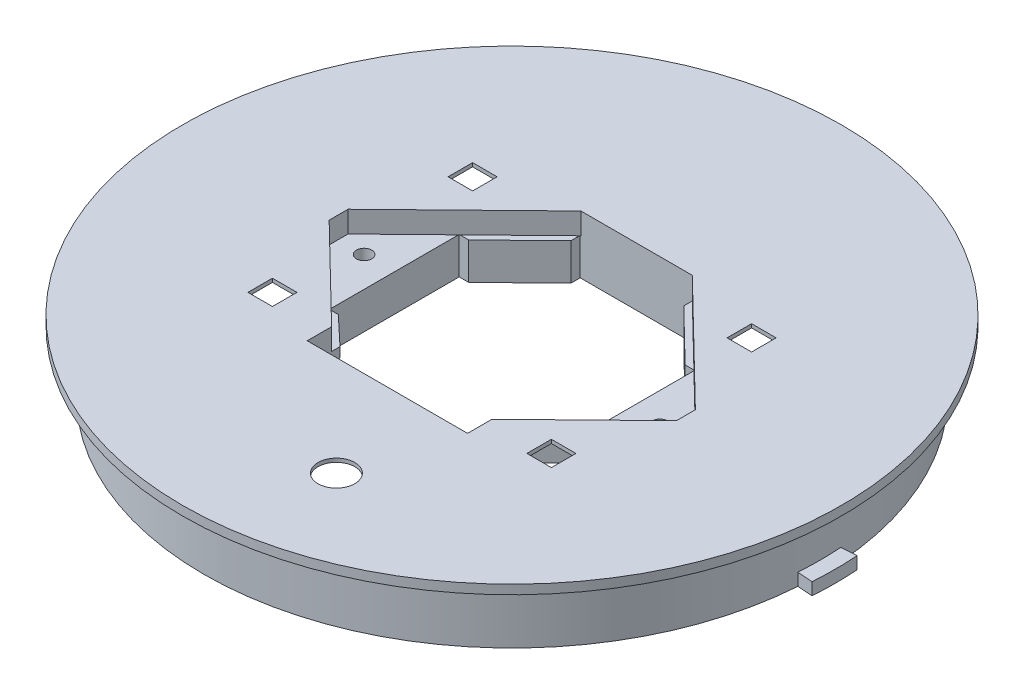
from build123d import *
from build123d.topology import SkipClean

# Parameters (mm, degrees)
SKETCH1_R           = 50.25
BOSS_EXTRUDE1_DEPTH = 8
SKETCH2_R           = 53.75
BOSS_EXTRUDE3_DEPTH = 1.5
SHELL1_T            = -1.6
REVOLVE1_START      = -1
REVOLVE1_DEPTH      = 1
BOSS_EXTRUDE4_START = 7.9
SKETCH6_R           = 48.65
BOSS_EXTRUDE4_DEPTH = 7.9
SKETCH5_W           = 9
SKETCH5_H           = 1.5
CUT_EXTRUDE1_DEPTH  = 3.5
SKETCH7_W           = 38
SKETCH7_H           = 20.772875816
SKETCH7_W_2         = 18
SKETCH7_H_2         = 9.738562092
CUT_EXTRUDE2_DEPTH  = 77.335607681
SHELL3_OUTLINE_R    = 48.65
SHELL3_DEPTH        = 7.9
SHELL3_2_DEPTH      = 4.4
BOSS_EXTRUDE6_DEPTH = 4.4
SKETCH8_R           = 1.25
CUT_EXTRUDE3_DEPTH  = 4
CUT_EXTRUDE4_START  = -4.4
SKETCH10_W          = 28.95
SKETCH10_H          = 4.698503494
CUT_EXTRUDE4_DEPTH  = 4.4
SKETCH11_R          = 3
CUT_EXTRUDE5_DEPTH  = 77.533228078
CUT_EXTRUDE6_DEPTH  = 3.5
SKETCH13_R          = 48.65
CUT_EXTRUDE7_DEPTH  = 1
CUT_EXTRUDE8_DEPTH  = 77.335607681
BOSS_EXTRUDE7_START = 1
SKETCH15_R          = 50.25
SKETCH15_R_2        = 48.65
BOSS_EXTRUDE7_DEPTH = 1
CUT_EXTRUDE9_DEPTH  = 77.335607681
BOSS_EXTRUDE8_DEPTH = 4.4
CUT_EXTRUDE10_DEPTH = 77.605319659
CUT_EXTRUDE11_START = -4.4
SKETCH19_W          = 8.012946077
SKETCH19_H          = 6.440058598
CUT_EXTRUDE11_DEPTH = 4.4
BOSS_EXTRUDE9_START = 1
SKETCH20_R          = 48.65
BOSS_EXTRUDE9_DEPTH = 1
SKETCH21_W          = 4
SKETCH21_H          = 4
CUT_EXTRUDE12_DEPTH = 77.878963312


# Read off the part's stored shape, not the designer's step: Revolve1, Shell3
with BuildPart() as part:
    # Sketch1 → Boss-Extrude1 (new body)
    with BuildSketch(Plane(origin=(0, 0, 0), x_dir=(1, 0, 0), z_dir=(0, 1, 0))):
        with Locations(Location((0, 0, 0), (0, 0, 270))):
            Circle(SKETCH1_R)
    extrude(amount=BOSS_EXTRUDE1_DEPTH)

    # Sketch2 → Boss-Extrude3 (add)
    with BuildSketch(Plane(origin=(0, 8, 0), x_dir=(1, 0, 0), z_dir=(0, 1, 0))):
        with Locations(Location((0, 0, 0), (0, 0, 270))):
            Circle(SKETCH2_R)
    extrude(amount=BOSS_EXTRUDE3_DEPTH)

    # Shell1
    shell1_openings = [part.faces().sort_by_distance(p)[0] for p in [
        (0, 0, 0),
    ]]
    offset(amount=SHELL1_T, openings=shell1_openings, kind=Kind.INTERSECTION)

    # Revolve1 outline → Revolve1 (add)
    with BuildSketch(Plane(origin=(0, 0, 0), x_dir=(1, 0, 0), z_dir=(0, 1, 0)).offset(REVOLVE1_START)):
        with BuildLine():
            ThreePointArc((-52.621503651, 3.67965399), (-52.75, 0), (-52.621503651, -3.67965399))
            Line((-52.621503651, -3.67965399), (-48.531491045, -3.393652448))
            ThreePointArc((-48.531491045, -3.393652448), (-48.65, 0), (-48.531491045, 3.393652448))
            Line((-48.531491045, 3.393652448), (-52.621503651, 3.67965399))
        make_face()
    revolve1 = extrude(amount=REVOLVE1_DEPTH)

    # Mirror1: Revolve1 across plane
    add(revolve1.mirror(Plane(origin=(0, 0, 0), x_dir=(0, 0, 1), z_dir=(1, 0, 0))))

    # Sketch6 → Boss-Extrude4 (add)
    with BuildSketch(Plane.XZ.offset(-7.9).offset(BOSS_EXTRUDE4_START)):
        Circle(SKETCH6_R)
    extrude(amount=-BOSS_EXTRUDE4_DEPTH)

    # Sketch5 → Cut-Extrude1 (cut)
    with BuildSketch(Plane(origin=(0, 9.5, 0), x_dir=(1, 0, 0), z_dir=(0, 1, 0))):
        with BuildLine():
            ThreePointArc((0, -14), (-4.78887909, -13.155479355), (-9, -10.723805295))
            Line((-9, -10.723805295), (-9, -20.125))
            Line((-9, -20.125), (0, -20.125))
            Line((0, -20.125), (0, -14))
        make_face()
        with BuildLine():
            ThreePointArc((9, -10.723805295), (4.78887909, -13.155479355), (0, -14))
            Line((0, -14), (0, -20.125))
            Line((0, -20.125), (9, -20.125))
            Line((9, -20.125), (9, -10.723805295))
        make_face()
        with BuildLine():
            ThreePointArc((13.919410907, -1.5), (12.352914438, -6.588285429), (9, -10.723805295))
            Line((9, -10.723805295), (9, -20.125))
            Line((9, -20.125), (12.875, -16.35130719))
            Line((12.875, -16.35130719), (28.125, -1.5))
            Line((28.125, -1.5), (13.919410907, -1.5))
        make_face()
        Polygon((12.875, -16.35130719), (9, -20.125), (12.875, -20.125), align=None)
        Polygon((-9, -20.125), (-12.875, -16.35130719), (-12.875, -20.125), align=None)
        with BuildLine():
            Line((-13.919410907, -1.5), (-28.125, -1.5))
            Line((-28.125, -1.5), (-12.875, -16.35130719))
            Line((-12.875, -16.35130719), (-9, -20.125))
            Line((-9, -20.125), (-9, -10.723805295))
            ThreePointArc((-9, -10.723805295), (-12.352914438, -6.588285429), (-13.919410907, -1.5))
        make_face()
        with BuildLine():
            Line((-9, -1.5), (-13.919410907, -1.5))
            ThreePointArc((-13.919410907, -1.5), (-12.352914438, -6.588285429), (-9, -10.723805295))
            Line((-9, -10.723805295), (-9, -1.5))
        make_face()
        with BuildLine():
            Line((0, -1.5), (-9, -1.5))
            Line((-9, -1.5), (-9, -10.723805295))
            ThreePointArc((-9, -10.723805295), (-4.78887909, -13.155479355), (0, -14))
            Line((0, -14), (0, -1.5))
        make_face()
        with BuildLine():
            Line((9, -1.5), (0, -1.5))
            Line((0, -1.5), (0, -14))
            ThreePointArc((0, -14), (4.78887909, -13.155479355), (9, -10.723805295))
            Line((9, -10.723805295), (9, -1.5))
        make_face()
        with BuildLine():
            Line((13.919410907, -1.5), (9, -1.5))
            Line((9, -1.5), (9, -10.723805295))
            ThreePointArc((9, -10.723805295), (12.352914438, -6.588285429), (13.919410907, -1.5))
        make_face()
        with BuildLine():
            ThreePointArc((14, 0), (13.979838209, -0.751081654), (13.919410907, -1.5))
            Line((13.919410907, -1.5), (28.125, -1.5))
            Line((28.125, -1.5), (28.125, 0))
            Line((28.125, 0), (26, 0))
            ThreePointArc((26, 0), (25.633883476, -0.883883476), (24.75, -1.25))
            Line((24.75, -1.25), (23.5, -1.25))
            ThreePointArc((23.5, -1.25), (22.616116524, -0.883883476), (22.25, 0))
            Line((22.25, 0), (14, 0))
        make_face()
        with BuildLine():
            Line((28.125, 0), (28.125, 1.5))
            Line((28.125, 1.5), (13.919410907, 1.5))
            ThreePointArc((13.919410907, 1.5), (13.979838209, 0.751081654), (14, 0))
            Line((14, 0), (22.25, 0))
            ThreePointArc((22.25, 0), (22.616116524, 0.883883476), (23.5, 1.25))
            Line((23.5, 1.25), (24.75, 1.25))
            ThreePointArc((24.75, 1.25), (25.633883476, 0.883883476), (26, 0))
            Line((26, 0), (28.125, 0))
        make_face()
        with BuildLine():
            Line((22.25, 0), (26, 0))
            ThreePointArc((26, 0), (25.633883476, 0.883883476), (24.75, 1.25))
            Line((24.75, 1.25), (23.5, 1.25))
            ThreePointArc((23.5, 1.25), (22.616116524, 0.883883476), (22.25, 0))
        make_face()
        with BuildLine():
            ThreePointArc((24.75, -1.25), (25.633883476, -0.883883476), (26, 0))
            Line((26, 0), (22.25, 0))
            ThreePointArc((22.25, 0), (22.616116524, -0.883883476), (23.5, -1.25))
            Line((23.5, -1.25), (24.75, -1.25))
        make_face()
        with BuildLine():
            Line((9, 0), (9, -1.5))
            Line((9, -1.5), (13.919410907, -1.5))
            ThreePointArc((13.919410907, -1.5), (13.979838209, -0.751081654), (14, 0))
            Line((14, 0), (9, 0))
        make_face()
        with BuildLine():
            Line((13.919410907, 1.5), (9, 1.5))
            Line((9, 1.5), (9, 0))
            Line((9, 0), (14, 0))
            ThreePointArc((14, 0), (13.979838209, 0.751081654), (13.919410907, 1.5))
        make_face()
        with Locations((4.5, 0.75)):
            Rectangle(SKETCH5_W, SKETCH5_H)
        with Locations((4.5, -0.75)):
            Rectangle(SKETCH5_W, SKETCH5_H)
        with Locations((-4.5, 0.75)):
            Rectangle(SKETCH5_W, SKETCH5_H)
        with Locations((-4.5, -0.75)):
            Rectangle(SKETCH5_W, SKETCH5_H)
        with BuildLine():
            ThreePointArc((-14, 0), (-13.979838209, -0.751081654), (-13.919410907, -1.5))
            Line((-13.919410907, -1.5), (-9, -1.5))
            Line((-9, -1.5), (-9, 0))
            Line((-9, 0), (-14, 0))
        make_face()
        with BuildLine():
            Line((-9, 1.5), (-13.919410907, 1.5))
            ThreePointArc((-13.919410907, 1.5), (-13.979838209, 0.751081654), (-14, 0))
            Line((-14, 0), (-9, 0))
            Line((-9, 0), (-9, 1.5))
        make_face()
        with BuildLine():
            Line((-28.125, 1.5), (-28.125, 0))
            Line((-28.125, 0), (-26, 0))
            ThreePointArc((-26, 0), (-25.633883476, 0.883883476), (-24.75, 1.25))
            Line((-24.75, 1.25), (-23.5, 1.25))
            ThreePointArc((-23.5, 1.25), (-22.616116524, 0.883883476), (-22.25, 0))
            Line((-22.25, 0), (-14, 0))
            ThreePointArc((-14, 0), (-13.979838209, 0.751081654), (-13.919410907, 1.5))
            Line((-13.919410907, 1.5), (-28.125, 1.5))
        make_face()
        with BuildLine():
            Line((-26, 0), (-28.125, 0))
            Line((-28.125, 0), (-28.125, -1.5))
            Line((-28.125, -1.5), (-13.919410907, -1.5))
            ThreePointArc((-13.919410907, -1.5), (-13.979838209, -0.751081654), (-14, 0))
            Line((-14, 0), (-22.25, 0))
            ThreePointArc((-22.25, 0), (-22.616116524, -0.883883476), (-23.5, -1.25))
            Line((-23.5, -1.25), (-24.75, -1.25))
            ThreePointArc((-24.75, -1.25), (-25.633883476, -0.883883476), (-26, 0))
        make_face()
        with BuildLine():
            Line((-22.25, 0), (-26, 0))
            ThreePointArc((-26, 0), (-25.633883476, -0.883883476), (-24.75, -1.25))
            Line((-24.75, -1.25), (-23.5, -1.25))
            ThreePointArc((-23.5, -1.25), (-22.616116524, -0.883883476), (-22.25, 0))
        make_face()
        with BuildLine():
            ThreePointArc((-24.75, 1.25), (-25.633883476, 0.883883476), (-26, 0))
            Line((-26, 0), (-22.25, 0))
            ThreePointArc((-22.25, 0), (-22.616116524, 0.883883476), (-23.5, 1.25))
            Line((-23.5, 1.25), (-24.75, 1.25))
        make_face()
        with BuildLine():
            Line((-9, 20.125), (-28.125, 1.5))
            Line((-28.125, 1.5), (-13.919410907, 1.5))
            ThreePointArc((-13.919410907, 1.5), (-12.352914438, 6.588285429), (-9, 10.723805295))
            Line((-9, 10.723805295), (-9, 20.125))
        make_face()
        with BuildLine():
            ThreePointArc((-9, 10.723805295), (-12.352914438, 6.588285429), (-13.919410907, 1.5))
            Line((-13.919410907, 1.5), (-9, 1.5))
            Line((-9, 1.5), (-9, 10.723805295))
        make_face()
        with BuildLine():
            Line((0, 20.125), (-9, 20.125))
            Line((-9, 20.125), (-9, 10.723805295))
            ThreePointArc((-9, 10.723805295), (-4.78887909, 13.155479355), (0, 14))
            Line((0, 14), (0, 20.125))
        make_face()
        with BuildLine():
            ThreePointArc((0, 14), (-4.78887909, 13.155479355), (-9, 10.723805295))
            Line((-9, 10.723805295), (-9, 1.5))
            Line((-9, 1.5), (0, 1.5))
            Line((0, 1.5), (0, 14))
        make_face()
        with BuildLine():
            ThreePointArc((9, 10.723805295), (4.78887909, 13.155479355), (0, 14))
            Line((0, 14), (0, 1.5))
            Line((0, 1.5), (9, 1.5))
            Line((9, 1.5), (9, 10.723805295))
        make_face()
        with BuildLine():
            Line((9, 20.125), (0, 20.125))
            Line((0, 20.125), (0, 14))
            ThreePointArc((0, 14), (4.78887909, 13.155479355), (9, 10.723805295))
            Line((9, 10.723805295), (9, 20.125))
        make_face()
        with BuildLine():
            Line((28.125, 1.5), (9, 20.125))
            Line((9, 20.125), (9, 10.723805295))
            ThreePointArc((9, 10.723805295), (12.352914438, 6.588285429), (13.919410907, 1.5))
            Line((13.919410907, 1.5), (28.125, 1.5))
        make_face()
        with BuildLine():
            ThreePointArc((13.919410907, 1.5), (12.352914438, 6.588285429), (9, 10.723805295))
            Line((9, 10.723805295), (9, 1.5))
            Line((9, 1.5), (13.919410907, 1.5))
        make_face()
    extrude(amount=-CUT_EXTRUDE1_DEPTH, mode=Mode.SUBTRACT)

    # Sketch7 → Cut-Extrude2 (cut, through all)
    with BuildSketch(Plane(origin=(0, 6, 0), x_dir=(1, 0, 0), z_dir=(0, 1, 0))):
        Polygon((12.875, -10.386437908), (-12.875, -10.386437908), (-12.875, -16.35130719), (-12.875, -20.125), (12.875, -20.125), (12.875, -16.35130719), align=None)
        Rectangle(SKETCH7_W, SKETCH7_H)
        with Locations((0, 15.255718954)):
            Rectangle(SKETCH7_W_2, SKETCH7_H_2)
    extrude(amount=-CUT_EXTRUDE2_DEPTH, mode=Mode.SUBTRACT)

    # Shell3 outline → Shell3 (cut)
    with BuildSketch(Plane(origin=(0, 0, 0), x_dir=(1, 0, 0), z_dir=(0, 1, 0))):
        Circle(SHELL3_OUTLINE_R)
        Polygon((9.650362184, 21.725), (29.725, 2.175189317), (29.725, -2.175189317), (14.475, -17.026496506), (14.475, -21.725), (-14.475, -21.725), (-14.475, -17.026496506), (-29.725, -2.175189317), (-29.725, 2.175189317), (-9.650362184, 21.725), align=None, mode=Mode.SUBTRACT)
    extrude(amount=SHELL3_DEPTH, mode=Mode.SUBTRACT)

    # Shell3 2 outline → Shell3 2 (cut)
    with BuildSketch(Plane(origin=(0, 0, 0), x_dir=(1, 0, 0), z_dir=(0, 1, 0))):
        Polygon((29.725, -2.175189317), (29.725, 2.175189317), (20.6, 11.061627225), (20.6, -11.061627225), align=None)
        Polygon((10.6, 11.986437908), (19.650362184, 11.986437908), (10.6, 20.800189317), align=None)
        Polygon((14.475, -17.026496506), (19.650362184, -11.986437908), (14.475, -11.986437908), align=None)
        Polygon((-10.6, 11.986437908), (-10.6, 20.800189317), (-19.650362184, 11.986437908), align=None)
        Polygon((-19.650362184, -11.986437908), (-14.475, -17.026496506), (-14.475, -11.986437908), align=None)
        Polygon((-20.6, -11.061627225), (-20.6, 11.061627225), (-29.725, 2.175189317), (-29.725, -2.175189317), align=None)
    extrude(amount=SHELL3_2_DEPTH, mode=Mode.SUBTRACT)

    # Sketch9 → Boss-Extrude6 (add)
    with BuildSketch(Plane.XZ.offset(-4.4)):
        Polygon((-20.6, 11.061627225), (-29.725, 2.175189317), (-29.725, -2.175189317), (-20.6, -11.061627225), align=None)
    boss_extrude6 = extrude(amount=BOSS_EXTRUDE6_DEPTH)

    # Mirror2: Boss-Extrude6 across plane
    add(boss_extrude6.mirror(Plane(origin=(0, 0, 0), x_dir=(0, 0, 1), z_dir=(1, 0, 0))))

    # Sketch8 → Cut-Extrude3 (cut)
    with BuildSketch(Plane(origin=(0, 6, 0), x_dir=(1, 0, 0), z_dir=(0, 1, 0))):
        with Locations(Location((-24.125, 0, 0), (0, 0, 270))):
            Circle(SKETCH8_R)
        with Locations(Location((24.125, 0, 0), (0, 0, 270))):
            Circle(SKETCH8_R)
    extrude(amount=-CUT_EXTRUDE3_DEPTH, mode=Mode.SUBTRACT)

    # Sketch10 → Cut-Extrude4 (cut)
    with BuildSketch(Plane.XZ.offset(CUT_EXTRUDE4_START)):
        with Locations((0, 19.375748253)):
            Rectangle(SKETCH10_W, SKETCH10_H)
    extrude(amount=CUT_EXTRUDE4_DEPTH, mode=Mode.SUBTRACT)

    # Sketch11 → Cut-Extrude5 (cut, through all)
    with BuildSketch(Plane.XZ.offset(-7.9)):
        with Locations(Location((8, 36.638158505, 0), (0, 0, 270))):
            Circle(SKETCH11_R)
    extrude(amount=-CUT_EXTRUDE5_DEPTH, mode=Mode.SUBTRACT)

    # Sketch12 → Cut-Extrude6 (cut)
    with BuildSketch(Plane(origin=(0, 9.5, 0), x_dir=(1, 0, 0), z_dir=(0, 1, 0))):
        Polygon((28.325, -1.5), (28.325, 1.584398665), (9.081295273, 20.325), (-9.081295273, 20.325), (-28.325, 1.584398665), (-28.325, -1.5), (-13.075, -16.35130719), (-13.075, -20.325), (13.075, -20.325), (13.075, -16.35130719), align=None)
    extrude(amount=-CUT_EXTRUDE6_DEPTH, mode=Mode.SUBTRACT)

    # Sketch13 → Cut-Extrude7 (cut)
    with BuildSketch(Plane.XZ.offset(-7.9)):
        with Locations(Location((0, 0, 0), (0, 0, 270))):
            Circle(SKETCH13_R)
        Polygon((-9.650362184, -21.725), (9.650362184, -21.725), (29.725, -2.175189317), (29.725, 2.175189317), (14.475, 17.026496506), (14.475, 21.725), (-14.475, 21.725), (-14.475, 17.026496506), (-29.725, 2.175189317), (-29.725, -2.175189317), align=None, mode=Mode.SUBTRACT)
    extrude(amount=-CUT_EXTRUDE7_DEPTH, mode=Mode.SUBTRACT)

    # Sketch14 → Cut-Extrude8 (cut, through all)
    with BuildSketch(Plane(origin=(0, 6, 0), x_dir=(1, 0, 0), z_dir=(0, 1, 0))):
        Polygon((-13.075, -20.325), (13.075, -20.325), (13.075, -10.586437908), (19.2, -10.586437908), (19.2, 10.586437908), (9.2, 10.586437908), (9.2, 20.325), (-9.2, 20.325), (-9.2, 10.586437908), (-19.2, 10.586437908), (-19.2, -10.586437908), (-13.075, -10.586437908), align=None)
    extrude(amount=-CUT_EXTRUDE8_DEPTH, mode=Mode.SUBTRACT)

    # Sketch15 → Boss-Extrude7 (add)
    with SkipClean():  # the faces are left unmerged after this step: merging them gives an invalid solid
        with BuildSketch(Plane.XZ.offset(BOSS_EXTRUDE7_START)):
            with Locations(Location((0, 0, 0), (0, 0, 356))):
                Circle(SKETCH15_R)
            with Locations(Location((0, 0, 0), (0, 0, 270))):
                Circle(SKETCH15_R_2, mode=Mode.SUBTRACT)
        extrude(amount=-BOSS_EXTRUDE7_DEPTH)

    # Sketch16 → Cut-Extrude9 (cut, through all)
    with SkipClean():  # the faces are left unmerged after this step: merging them gives an invalid solid
        with BuildSketch(Plane(origin=(0, 6, 0), x_dir=(1, 0, 0), z_dir=(0, 1, 0))):
            Polygon((-17.64797327, 10.586437908), (-9.2, 10.586437908), (-9.2, 18.813549133), align=None)
            Polygon((17.64797327, 10.586437908), (9.2, 10.586437908), (9.2, 18.813549133), align=None)
        extrude(amount=-CUT_EXTRUDE9_DEPTH, mode=Mode.SUBTRACT)

    # Sketch17 → Boss-Extrude8 (add)
    with SkipClean():  # the faces are left unmerged after this step: merging them gives an invalid solid
        with BuildSketch(Plane.XZ.offset(-4.4)):
            Polygon((19.650362184, -11.986437908), (16.210389378, -11.986437908), (10.6, -17.45015044), (10.6, -20.800189317), align=None)
            Polygon((-10.6, -20.800189317), (-10.6, -17.45015044), (-16.210389378, -11.986437908), (-19.650362184, -11.986437908), align=None)
        extrude(amount=BOSS_EXTRUDE8_DEPTH)

    # Sketch18 → Cut-Extrude10 (cut, through all)
    with SkipClean():  # the faces are left unmerged after this step: merging them gives an invalid solid
        with BuildSketch(Plane.XZ):
            Polygon((13.075, 10.586437908), (17.740944739, 10.586437908), (16.2534869, 11.986437908), (14.475, 11.986437908), (14.475, 13.660355377), (13.075, 14.978039785), align=None)
            Polygon((14.475, 11.986437908), (16.2534869, 11.986437908), (14.475, 13.660355377), align=None)
        cut_extrude10 = extrude(amount=-CUT_EXTRUDE10_DEPTH, mode=Mode.SUBTRACT)

    # Sketch19 → Cut-Extrude11 (cut)
    with SkipClean():  # the faces are left unmerged after this step: merging them gives an invalid solid
        with BuildSketch(Plane.XZ.offset(CUT_EXTRUDE11_START)):
            with Locations((17.081473039, 13.806467207)):
                Rectangle(SKETCH19_W, SKETCH19_H)
        cut_extrude11 = extrude(amount=CUT_EXTRUDE11_DEPTH, mode=Mode.SUBTRACT)

    # Mirror3: Cut-Extrude10, Cut-Extrude11 across plane
    with SkipClean():  # the faces are left unmerged after this step: merging them gives an invalid solid
        add(cut_extrude10.mirror(Plane(origin=(0, 0, 0), x_dir=(0, 0, 1), z_dir=(1, 0, 0))), mode=Mode.SUBTRACT)
        add(cut_extrude11.mirror(Plane(origin=(0, 0, 0), x_dir=(0, 0, 1), z_dir=(1, 0, 0))), mode=Mode.SUBTRACT)

    # Sketch20 → Boss-Extrude9 (add)
    with SkipClean():  # the faces are left unmerged after this step: merging them gives an invalid solid
        with BuildSketch(Plane.XZ.offset(1).offset(BOSS_EXTRUDE9_START)):
            with BuildLine():
                Line((-50.127593526, 3.505262806), (-52.621503651, 3.67965399))
                ThreePointArc((-52.621503651, 3.67965399), (-52.75, 0), (-52.621503651, -3.67965399))
                Line((-52.621503651, -3.67965399), (-50.127593526, -3.505262806))
                ThreePointArc((-50.127593526, -3.505262806), (0, -50.25), (50.127593526, -3.505262806))
                Line((50.127593526, -3.505262806), (52.621503651, -3.67965399))
                ThreePointArc((52.621503651, -3.67965399), (52.75, 0), (52.621503651, 3.67965399))
                Line((52.621503651, 3.67965399), (50.127593526, 3.505262806))
                ThreePointArc((50.127593526, 3.505262806), (0, 50.25), (-50.127593526, 3.505262806))
            make_face()
            with Locations(Location((0, 0, 0), (0, 0, 270))):
                Circle(SKETCH20_R, mode=Mode.SUBTRACT)
        extrude(amount=-BOSS_EXTRUDE9_DEPTH)

    # Sketch21 → Cut-Extrude12 (cut, through all)
    with SkipClean():  # the faces are left unmerged after this step: merging them gives an invalid solid
        with BuildSketch(Plane(origin=(0, 9.5, 0), x_dir=(1, 0, 0), z_dir=(0, 1, 0))):
            with Locations((-22.750584256, 16.325)):
                Rectangle(SKETCH21_W, SKETCH21_H)
            with Locations((22.750584256, 16.325)):
                Rectangle(SKETCH21_W, SKETCH21_H)
            with Locations((22.750584256, -16.325)):
                Rectangle(SKETCH21_W, SKETCH21_H)
            with Locations((-22.750584256, -16.325)):
                Rectangle(SKETCH21_W, SKETCH21_H)
        extrude(amount=-CUT_EXTRUDE12_DEPTH, mode=Mode.SUBTRACT)


solid = part.part
